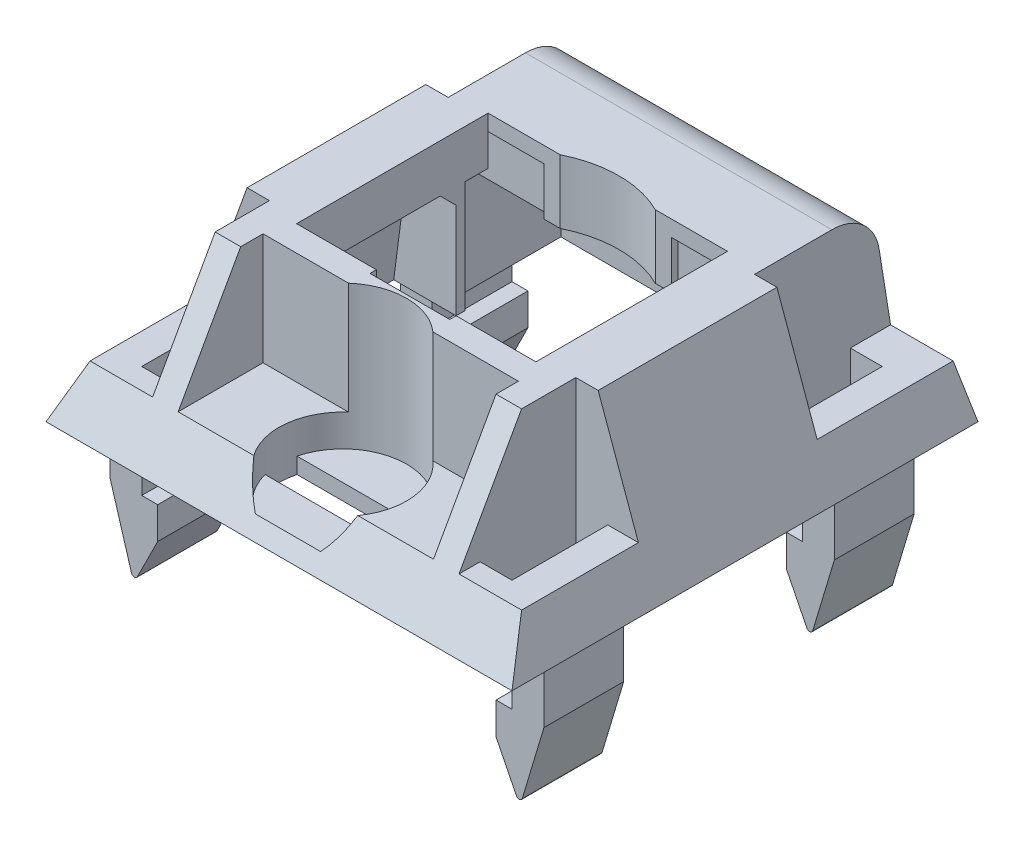
from build123d import *

# Parameters (mm, degrees)
FILLET1_R               = 1.5
SKETCH4_W               = 2.5
SKETCH4_H               = 4.5
SKETCH4_W_2             = 8
SKETCH4_H_2             = 3.5
CUT_EXTRUDE1_DEPTH      = 3.5
SKETCH3_W               = 7.5
SKETCH3_H               = 6
CUT_EXTRUDE2_DEPTH      = 12.470832747
CUT_EXTRUDE5_DEPTH      = 11.900917559
CUT_EXTRUDE5_DEPTH_BACK = 1
SKETCH5_R               = 2
CUT_EXTRUDE6_START      = -0.5
CUT_EXTRUDE6_DEPTH      = 1.5
SKETCH9_W               = 1
SKETCH9_H               = 3
CUT_EXTRUDE9_DEPTH      = 12.470832747
CUT_EXTRUDE10_DEPTH     = 0.7
CUT_EXTRUDE11_DEPTH     = 0.7
CUT_EXTRUDE12_DEPTH     = 4
BOSS_EXTRUDE1_DEPTH     = 2
BOSS_EXTRUDE2_DEPTH     = 2
CUT_EXTRUDE17_DEPTH     = 0.45
CUT_EXTRUDE18_DEPTH     = 0.45
CUT_EXTRUDE19_DEPTH     = 0.5
CUT_EXTRUDE20_DEPTH     = 0.5
CUT_EXTRUDE22_START     = -3.5
SKETCH29_W              = 8.5
SKETCH29_H              = 3.5
CUT_EXTRUDE22_DEPTH     = 3.5
BOSS_EXTRUDE6_DEPTH     = 0.5
SKETCH33_W              = 2.25
SKETCH33_H              = 0.2
CUT_EXTRUDE23_DEPTH     = 1.5
SKETCH35_W              = 6.5
SKETCH35_H              = 2.080921332
CUT_EXTRUDE24_DEPTH     = 1
CUT_EXTRUDE25_DEPTH     = 11.750814086
SKETCH37_W              = 1.75
SKETCH37_H              = 0.2
CUT_EXTRUDE26_DEPTH     = 4.5
SKETCH38_W              = 2.5
SKETCH38_H              = 0.2
CUT_EXTRUDE27_DEPTH     = 12.470832747
SKETCH39_W              = 1
SKETCH39_H              = 2.5
BOSS_EXTRUDE9_DEPTH     = 2
SKETCH40_W              = 1.5
SKETCH40_H              = 2.5
BOSS_EXTRUDE10_DEPTH    = 2.5
CUT_EXTRUDE28_DEPTH     = 16.808225868
FILLET3_R               = 0.1


with BuildPart() as part:
    # Sketch1 → Loft1 section 0
    with BuildSketch(Plane(origin=(0, 0, 0), x_dir=(1, 0, 0), z_dir=(0, 1, 0))):
        with BuildLine():
            Line((-7.3, 7.3), (7.3, 7.3))
            Line((7.3, 7.3), (7.3, -7.3))
            Line((7.3, -7.3), (-7.3, -7.3))
            Line((-7.3, -7.3), (-7.3, 7.3))
        make_face()
    # Sketch2 → Loft1 section 1
    with BuildSketch(Plane(origin=(0, 5, 0), x_dir=(1, 0, 0), z_dir=(0, 1, 0))):
        with BuildLine():
            Line((-5.5, 6.5), (5.5, 6.5))
            Line((5.5, 6.5), (5.5, -4.5))
            Line((5.5, -4.5), (-5.5, -4.5))
            Line((-5.5, -4.5), (-5.5, 6.5))
        make_face()
    loft()

    # Fillet1
    fillet1_edges = [part.edges().sort_by_distance(p)[0] for p in [
        (0, 5, -6.5),
    ]]
    fillet(fillet1_edges, radius=FILLET1_R)

    # Sketch4 → Cut-Extrude1 (cut)
    with BuildSketch(Plane(origin=(0, 5, 0), x_dir=(1, 0, 0), z_dir=(0, 1, 0))):
        with Locations((-6.05, -5.05)):
            Rectangle(SKETCH4_W, SKETCH4_H)
        with Locations((6.05, 5.05)):
            Rectangle(SKETCH4_W, SKETCH4_H)
        with Locations((-6.05, 5.05)):
            Rectangle(SKETCH4_W, SKETCH4_H)
        with Locations((6.05, -5.05)):
            Rectangle(SKETCH4_W, SKETCH4_H)
        with Locations((0, -5.55)):
            Rectangle(SKETCH4_W_2, SKETCH4_H_2)
    extrude(amount=-CUT_EXTRUDE1_DEPTH, mode=Mode.SUBTRACT)

    # Shell2: read off the stored shape, not the designer's step
    # Shell2: loft between two sections, ruled curve by curve
    shell2_from = [
        Edge.make_line((5.705760369, 0, 1.3), (5.705760369, 0, -1.3)),
        Edge.make_line((-3.3, 0, -5.780921332), (3.3, 0, -5.780921332)),
        Edge.make_line((-5.705760369, 0, 1.3), (-5.705760369, 0, -1.3)),
        Edge.make_line((5.705760369, 0, -1.3), (3.3, 0, -1.3)),
        Edge.make_line((-5.705760369, 0, -1.3), (-3.3, 0, -1.3)),
        Edge.make_line((3.3, 0, -5.780921332), (3.3, 0, -1.3)),
        Edge.make_line((3.3, 0, 1.3), (3.3, 0, 2.3)),
        Edge.make_line((-3.3, 0, -5.780921332), (-3.3, 0, -1.3)),
        Edge.make_line((-3.3, 0, 2.3), (-3.3, 0, 1.3)),
        Edge.make_line((-3.3, 0, 1.3), (-5.705760369, 0, 1.3)),
        Edge.make_line((5.705760369, 0, 1.3), (3.3, 0, 1.3)),
        Edge.make_line((3.3, 0, 2.3), (-3.3, 0, 2.3)),
    ]
    shell2_to = [
        Edge.make_line((4.445760369, 3.5, 1.3), (4.445760369, 3.5, -1.3)),
        Edge.make_line((-3.3, 3.5, -5.220921332), (3.3, 3.5, -5.220921332)),
        Edge.make_line((-4.445760369, 3.5, 1.3), (-4.445760369, 3.5, -1.3)),
        Edge.make_line((4.445760369, 3.5, -1.3), (3.3, 3.5, -1.3)),
        Edge.make_line((-4.445760369, 3.5, -1.3), (-3.3, 3.5, -1.3)),
        Edge.make_line((3.3, 3.5, -5.220921332), (3.3, 3.5, -1.3)),
        Edge.make_line((3.3, 3.5, 1.3), (3.3, 3.5, 2.3)),
        Edge.make_line((-3.3, 3.5, -5.220921332), (-3.3, 3.5, -1.3)),
        Edge.make_line((-3.3, 3.5, 2.3), (-3.3, 3.5, 1.3)),
        Edge.make_line((-3.3, 3.5, 1.3), (-4.445760369, 3.5, 1.3)),
        Edge.make_line((4.445760369, 3.5, 1.3), (3.3, 3.5, 1.3)),
        Edge.make_line((3.3, 3.5, 2.3), (-3.3, 3.5, 2.3)),
    ]
    shell2 = Solid(Shell([*[Face.make_surface_from_curves(shell2_from[k], shell2_to[k]) for k in range(12)], Face(Wire(shell2_from)), Face(Wire(shell2_to))]))
    add(shell2, mode=Mode.SUBTRACT)

    # Sketch3 → Cut-Extrude2 (cut, through all)
    with BuildSketch(Plane.XZ):
        Rectangle(SKETCH3_W, SKETCH3_H)
    extrude(amount=-CUT_EXTRUDE2_DEPTH, mode=Mode.SUBTRACT)

    # Sketch5 → Cut-Extrude5 (cut, two sides: drawn at the far end of the back side and taken through both)
    with BuildSketch(Plane(origin=(0, 1.5, 0), x_dir=(1, 0, 0), z_dir=(0, 1, 0)).offset(-CUT_EXTRUDE5_DEPTH_BACK)):
        with Locations((0, -5.3)):
            Circle(SKETCH5_R)
    extrude(amount=CUT_EXTRUDE5_DEPTH + CUT_EXTRUDE5_DEPTH_BACK, mode=Mode.SUBTRACT)

    # Cut-Extrude6: read off the stored shape, not the designer's step
    # Cut-Extrude6 outline → Cut-Extrude6 (cut)
    with BuildSketch(Plane.XZ.offset(CUT_EXTRUDE6_START)):
        with BuildLine():
            Line((1.936491673, 5.8), (-1.936491673, 5.8))
            ThreePointArc((-1.936491673, 5.8), (-2, 5.3), (-1.936491673, 4.8))
            Line((-1.936491673, 4.8), (1.936491673, 4.8))
            ThreePointArc((1.936491673, 4.8), (2, 5.3), (1.936491673, 5.8))
        make_face()
    extrude(amount=CUT_EXTRUDE6_DEPTH, mode=Mode.SUBTRACT)

    # Sketch9 → Cut-Extrude9 (cut, through all)
    with BuildSketch(Plane(origin=(0, 0, 0), x_dir=(1, 0, 0), z_dir=(0, 1, 0))):
        with Locations((-5.3, 4.3)):
            Rectangle(SKETCH9_W, SKETCH9_H)
        with Locations((5.3, 4.3)):
            Rectangle(SKETCH9_W, SKETCH9_H)
        with Locations((-5.3, -4.3)):
            Rectangle(SKETCH9_W, SKETCH9_H)
        with Locations((5.3, -4.3)):
            Rectangle(SKETCH9_W, SKETCH9_H)
    extrude(amount=CUT_EXTRUDE9_DEPTH, mode=Mode.SUBTRACT)

    # Sketch11 → Cut-Extrude10 (cut)
    with BuildSketch(Plane(origin=(0, 0, 1.3), x_dir=(-1, 0, 0), z_dir=(0, 0, -1))):
        Polygon((-3.75, 0), (-5.705760369, 0), (-4.445760369, 3.5), (-3.75, 3.5), align=None)
        Polygon((3.75, 0), (3.75, 3.5), (4.445760369, 3.5), (5.705760369, 0), align=None)
    extrude(amount=-CUT_EXTRUDE10_DEPTH, mode=Mode.SUBTRACT)

    # Sketch12 → Cut-Extrude11 (cut)
    with BuildSketch(Plane.XY.offset(-1.3)):
        Polygon((3.75, 0), (5.705760369, 0), (4.445760369, 3.5), (3.75, 3.5), align=None)
        Polygon((-3.75, 0), (-5.705760369, 0), (-4.445760369, 3.5), (-3.75, 3.5), align=None)
    extrude(amount=-CUT_EXTRUDE11_DEPTH, mode=Mode.SUBTRACT)

    # Sketch13 → Cut-Extrude12 (cut)
    with BuildSketch(Plane(origin=(0, 0, 2), x_dir=(-1, 0, 0), z_dir=(0, 0, -1))):
        Polygon((3.75, 3.5), (5.25, 3.5), (5.705760369, 0), (3.75, 0), align=None)
        Polygon((-3.75, 3.5), (-5.25, 3.5), (-5.705760369, 0), (-3.75, 0), align=None)
    extrude(amount=CUT_EXTRUDE12_DEPTH, mode=Mode.SUBTRACT)

    # Sketch14 → Boss-Extrude1 (add)
    with BuildSketch(Plane(origin=(-3.75, 0, 0), x_dir=(0, 0, -1), z_dir=(1, 0, 0))):
        Polygon((-2, 3.5), (-1.5, 3.5), (-2, 3), align=None)
        Polygon((1.5, 3.5), (2, 3.5), (2, 3), align=None)
    extrude(amount=-BOSS_EXTRUDE1_DEPTH)

    # Sketch15 → Boss-Extrude2 (add)
    with BuildSketch(Plane.ZY.offset(-3.75)):
        Polygon((2, 3.5), (2, 3), (1.5, 3.5), align=None)
        Polygon((-2, 3.5), (-2, 3), (-1.5, 3.5), align=None)
    extrude(amount=-BOSS_EXTRUDE2_DEPTH)

    # Sketch18 → Cut-Extrude17 (cut)
    with BuildSketch(Plane(origin=(-3.3, 0, 0), x_dir=(0, 0, -1), z_dir=(1, 0, 0))):
        Polygon((5.220921332, 3.5), (3, 3.5), (3, 0), (5.780921332, 0), align=None)
    extrude(amount=-CUT_EXTRUDE17_DEPTH, mode=Mode.SUBTRACT)

    # Sketch19 → Cut-Extrude18 (cut)
    with BuildSketch(Plane.ZY.offset(-3.3)):
        Polygon((-5.780921332, 0), (-3, 0), (-3, 3.5), (-5.220921332, 3.5), align=None)
    extrude(amount=-CUT_EXTRUDE18_DEPTH, mode=Mode.SUBTRACT)

    # Sketch22 → Cut-Extrude19 (cut)
    with BuildSketch(Plane(origin=(-3.75, 0, 0), x_dir=(0, 0, -1), z_dir=(1, 0, 0))):
        Polygon((5.780921332, 0), (2.280921332, 0), (2.280921332, 3.5), (5.220921332, 3.5), align=None)
    extrude(amount=-CUT_EXTRUDE19_DEPTH, mode=Mode.SUBTRACT)

    # Sketch23 → Cut-Extrude20 (cut)
    with BuildSketch(Plane.ZY.offset(-3.75)):
        Polygon((-5.780921332, 0), (-2.280921332, 0), (-2.280921332, 3.5), (-5.220921332, 3.5), align=None)
    extrude(amount=-CUT_EXTRUDE20_DEPTH, mode=Mode.SUBTRACT)

    # Sketch29 → Cut-Extrude22 (cut)
    with BuildSketch(Plane.XZ.offset(CUT_EXTRUDE22_START)):
        with Locations((0, -4.030921332)):
            Rectangle(SKETCH29_W, SKETCH29_H)
    extrude(amount=CUT_EXTRUDE22_DEPTH, mode=Mode.SUBTRACT)

    # Sketch31 → Boss-Extrude6 (add)
    with BuildSketch(Plane.XZ.offset(-3.5)):
        Polygon((-4.25, -3), (-4.25, -5.780921332), (-3.25, -5.780921332), (-3.25, -3.7), (3.25, -3.7), (3.25, -5.780921332), (4.25, -5.780921332), (4.25, -3), (3.75, -3), (-3.75, -3), align=None)
    extrude(amount=BOSS_EXTRUDE6_DEPTH)

    # Sketch33 → Cut-Extrude23 (cut)
    with BuildSketch(Plane.XZ.offset(-3)):
        with Locations((-3.125, -3.1)):
            Rectangle(SKETCH33_W, SKETCH33_H)
        with Locations((3.125, -3.1)):
            Rectangle(SKETCH33_W, SKETCH33_H)
    extrude(amount=-CUT_EXTRUDE23_DEPTH, mode=Mode.SUBTRACT)

    # Sketch35 → Cut-Extrude24 (cut)
    with BuildSketch(Plane.XZ.offset(-3.5)):
        with Locations((0, -4.740460666)):
            Rectangle(SKETCH35_W, SKETCH35_H)
    extrude(amount=-CUT_EXTRUDE24_DEPTH, mode=Mode.SUBTRACT)

    # Sketch36 → Cut-Extrude25 (cut, through all)
    with BuildSketch(Plane.XZ.offset(-3)):
        with BuildLine():
            Line((-1.490805152, -3), (1.490805152, -3))
            ThreePointArc((1.490805152, -3), (0, -3.35), (-1.490805152, -3))
        make_face()
    extrude(amount=-CUT_EXTRUDE25_DEPTH, mode=Mode.SUBTRACT)

    # Sketch37 → Cut-Extrude26 (cut)
    with BuildSketch(Plane.XZ):
        with Locations((-2.875, 3.1)):
            Rectangle(SKETCH37_W, SKETCH37_H)
        with Locations((2.875, 3.1)):
            Rectangle(SKETCH37_W, SKETCH37_H)
    extrude(amount=-CUT_EXTRUDE26_DEPTH, mode=Mode.SUBTRACT)

    # Sketch38 → Cut-Extrude27 (cut, through all)
    with BuildSketch(Plane.XZ):
        with Locations((0, 3.1)):
            Rectangle(SKETCH38_W, SKETCH38_H)
    extrude(amount=-CUT_EXTRUDE27_DEPTH, mode=Mode.SUBTRACT)

    # Sketch39 → Boss-Extrude9 (add)
    with BuildSketch(Plane.XZ):
        with Locations((-6.3, 4.55)):
            Rectangle(SKETCH39_W, SKETCH39_H)
        with Locations((-6.3, -4.55)):
            Rectangle(SKETCH39_W, SKETCH39_H)
        with Locations((6.3, 4.55)):
            Rectangle(SKETCH39_W, SKETCH39_H)
        with Locations((6.3, -4.55)):
            Rectangle(SKETCH39_W, SKETCH39_H)
    extrude(amount=BOSS_EXTRUDE9_DEPTH)

    # Sketch40 → Boss-Extrude10 (add)
    with BuildSketch(Plane.XZ.offset(2)):
        with Locations((-6.05, 4.55)):
            Rectangle(SKETCH40_W, SKETCH40_H)
        with Locations((-6.05, -4.55)):
            Rectangle(SKETCH40_W, SKETCH40_H)
        with Locations((6.05, 4.55)):
            Rectangle(SKETCH40_W, SKETCH40_H)
        with Locations((6.05, -4.55)):
            Rectangle(SKETCH40_W, SKETCH40_H)
    extrude(amount=BOSS_EXTRUDE10_DEPTH)

    # Sketch41 → Cut-Extrude28 (cut, through all)
    with BuildSketch(Plane.XY.offset(5.8)):
        Polygon((-6.05, -4.5), (-6.8, -2), (-6.8, -4.5), align=None)
        Polygon((-5.3, -3), (-6.05, -4.5), (-5.3, -4.5), align=None)
        Polygon((5.3, -4.5), (6.05, -4.5), (5.3, -3), align=None)
        Polygon((6.8, -4.5), (6.8, -2), (6.05, -4.5), align=None)
    extrude(amount=-CUT_EXTRUDE28_DEPTH, mode=Mode.SUBTRACT)

    # Fillet3
    fillet3_edges = [part.edges().sort_by_distance(p)[0] for p in [
        (6.05, -4.5, -4.55),
        (-6.05, -4.5, -4.55),
        (-6.05, -4.5, 4.55),
        (6.05, -4.5, 4.55),
    ]]
    fillet(fillet3_edges, radius=FILLET3_R)


solid = part.part
